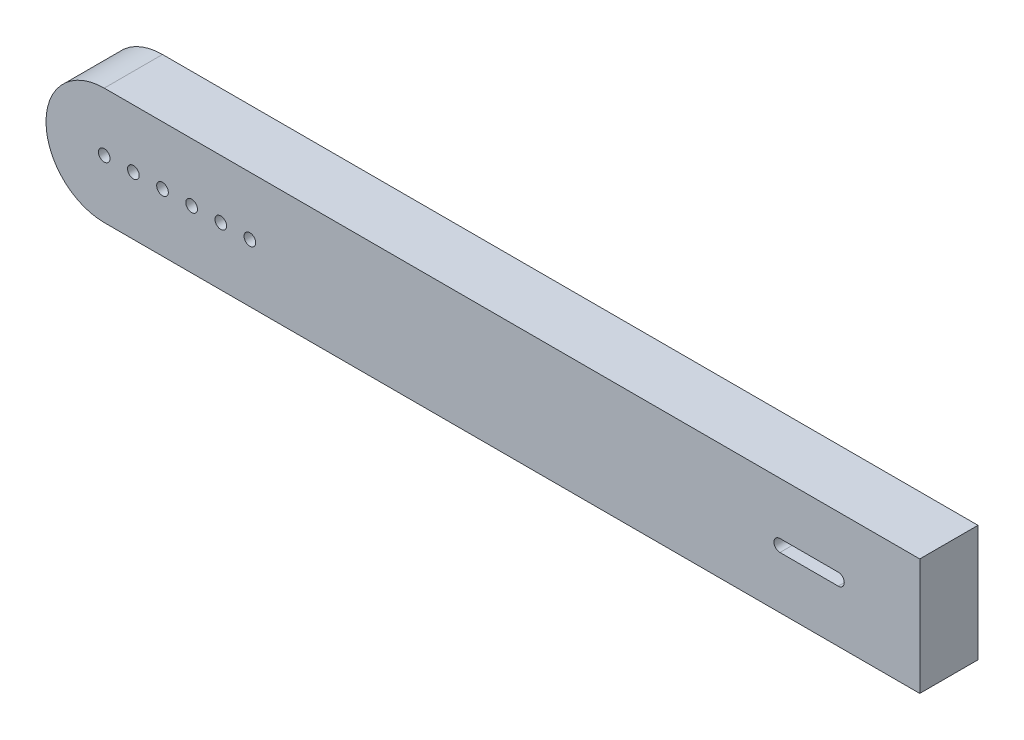
from build123d import *

# Parameters (mm, degrees)
BOSS_EXTRUDE3_DEPTH = 6.35
CUT_EXTRUDE2_DEPTH  = 25.4


with BuildPart() as part:
    # Sketch1 → Boss-Extrude3 (new body)
    with BuildSketch(Plane.XY):
        with BuildLine():
            ThreePointArc((-40.954752736, 5.850678962), (-47.304752736, -0.499321038), (-40.954752736, -6.849321038))
            Line((-40.954752736, -6.849321038), (47.945247264, -6.849321038))
            Line((47.945247264, -6.849321038), (47.945247264, 5.850678962))
            Line((47.945247264, 5.850678962), (-40.954752736, 5.850678962))
        make_face()
        with BuildLine():
            ThreePointArc((-40.319752736, -0.499321038), (-40.954490658, -1.134320984), (-41.589752519, -0.499845193))
            ThreePointArc((-41.589752519, -0.499845193), (-40.955276891, 0.135678746), (-40.319752952, -0.498796882))
            ThreePointArc((-40.319752952, -0.498796882), (-40.31975279, -0.49905896), (-40.319752736, -0.499321038))
        make_face(mode=Mode.SUBTRACT)
        with BuildLine():
            Line((-37.144752749, -0.499189999), (-37.144752736, -0.499321038))
            ThreePointArc((-37.144752736, -0.499321038), (-38.414752732, -0.499386557), (-37.144752749, -0.499189999))
        make_face(mode=Mode.SUBTRACT)
        with BuildLine():
            ThreePointArc((-33.969752736, -0.499321038), (-34.604752736, -1.134321038), (-35.239752736, -0.499321038))
            ThreePointArc((-35.239752736, -0.499321038), (-34.604752736, 0.135678962), (-33.969752736, -0.499321038))
        make_face(mode=Mode.SUBTRACT)
        with BuildLine():
            ThreePointArc((-30.794752736, -0.499321038), (-31.429752736, -1.134321038), (-32.064752736, -0.499321038))
            ThreePointArc((-32.064752736, -0.499321038), (-31.429752736, 0.135678962), (-30.794752736, -0.499321038))
        make_face(mode=Mode.SUBTRACT)
        with BuildLine():
            ThreePointArc((-27.619752736, -0.499321038), (-28.254752736, -1.134321038), (-28.889752736, -0.499321038))
            ThreePointArc((-28.889752736, -0.499321038), (-28.254752736, 0.135678962), (-27.619752736, -0.499321038))
        make_face(mode=Mode.SUBTRACT)
        with BuildLine():
            ThreePointArc((-24.444752736, -0.499321038), (-25.079752736, -1.134321038), (-25.714752736, -0.499321038))
            ThreePointArc((-25.714752736, -0.499321038), (-25.079752736, 0.135678962), (-24.444752736, -0.499321038))
        make_face(mode=Mode.SUBTRACT)
        with BuildLine():
            ThreePointArc((32.070247264, -0.499321038), (32.705247264, 0.135678962), (33.340247264, -0.499321038))
            ThreePointArc((33.340247264, -0.499321038), (32.705247264, -1.134321038), (32.070247264, -0.499321038))
        make_face(mode=Mode.SUBTRACT)
        with BuildLine():
            ThreePointArc((35.245247264, -0.499321038), (35.880247264, 0.135678962), (36.515247264, -0.499321038))
            ThreePointArc((36.515247264, -0.499321038), (35.880247264, -1.134321038), (35.245247264, -0.499321038))
        make_face(mode=Mode.SUBTRACT)
        with BuildLine():
            ThreePointArc((38.420247264, -0.499321038), (39.055247264, 0.135678962), (39.690247264, -0.499321038))
            ThreePointArc((39.690247264, -0.499321038), (39.055247264, -1.134321038), (38.420247264, -0.499321038))
        make_face(mode=Mode.SUBTRACT)
    extrude(amount=BOSS_EXTRUDE3_DEPTH)

    # Sketch2 → Cut-Extrude2 (cut)
    with BuildSketch(Plane.XY.offset(6.35)):
        with BuildLine():
            Line((32.705247264, -1.159721038), (39.055247264, -1.159721038))
            ThreePointArc((39.055247264, -1.159721038), (39.715647264, -0.499321038), (39.055247264, 0.161078962))
            Line((39.055247264, 0.161078962), (32.705247264, 0.161078962))
            ThreePointArc((32.705247264, 0.161078962), (32.044847264, -0.499321038), (32.705247264, -1.159721038))
        make_face()
    extrude(amount=-CUT_EXTRUDE2_DEPTH, mode=Mode.SUBTRACT)


solid = part.part
